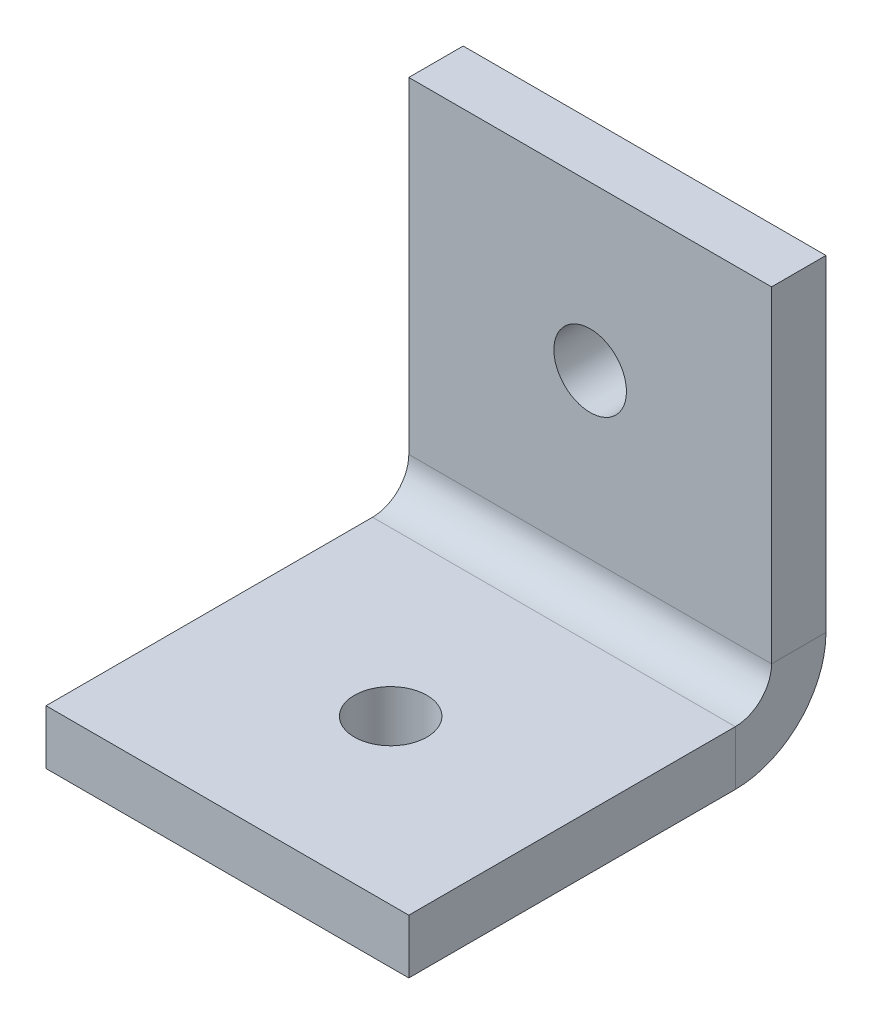
from build123d import *

# Parameters (mm, degrees)
BASE_FLANGE1_DEPTH = 20
SKETCH6_R          = 2
CUT_EXTRUDE1_DEPTH = 10
SKETCH7_R          = 2
CUT_EXTRUDE2_DEPTH = 3


# Sheet-metal steps are written as plain solids
with BuildPart() as part:
    # Sketch1 → Base-Flange1 (new body)
    with BuildSketch(Plane(origin=(0, 0, 0), x_dir=(0, 0, -1), z_dir=(1, 0, 0))):
        with BuildLine():
            Line((0, 20), (0, 2))
            ThreePointArc((0, 2), (-0.585786438, 0.585786438), (-2, 0))
            Line((-2, 0), (-20, 0))
            Line((-20, 0), (-20, -3))
            Line((-20, -3), (-2, -3))
            ThreePointArc((-2, -3), (1.535533906, -1.535533906), (3, 2))
            Line((3, 2), (3, 20))
            Line((3, 20), (0, 20))
        make_face()
    extrude(amount=BASE_FLANGE1_DEPTH)

    # Sketch6 → Cut-Extrude1 (cut)
    with BuildSketch(Plane(origin=(0, 0, -3), x_dir=(-1, 0, 0), z_dir=(0, 0, -1))):
        with Locations(Location((-10, 11, 0), (0, 0, 90))):
            Circle(SKETCH6_R)
    extrude(amount=-CUT_EXTRUDE1_DEPTH, mode=Mode.SUBTRACT)

    # Sketch7 → Cut-Extrude2 (cut)
    with BuildSketch(Plane.XZ.offset(3)):
        with Locations(Location((10, 11, 0), (0, 0, 270))):
            Circle(SKETCH7_R)
    extrude(amount=-CUT_EXTRUDE2_DEPTH, mode=Mode.SUBTRACT)


solid = part.part
